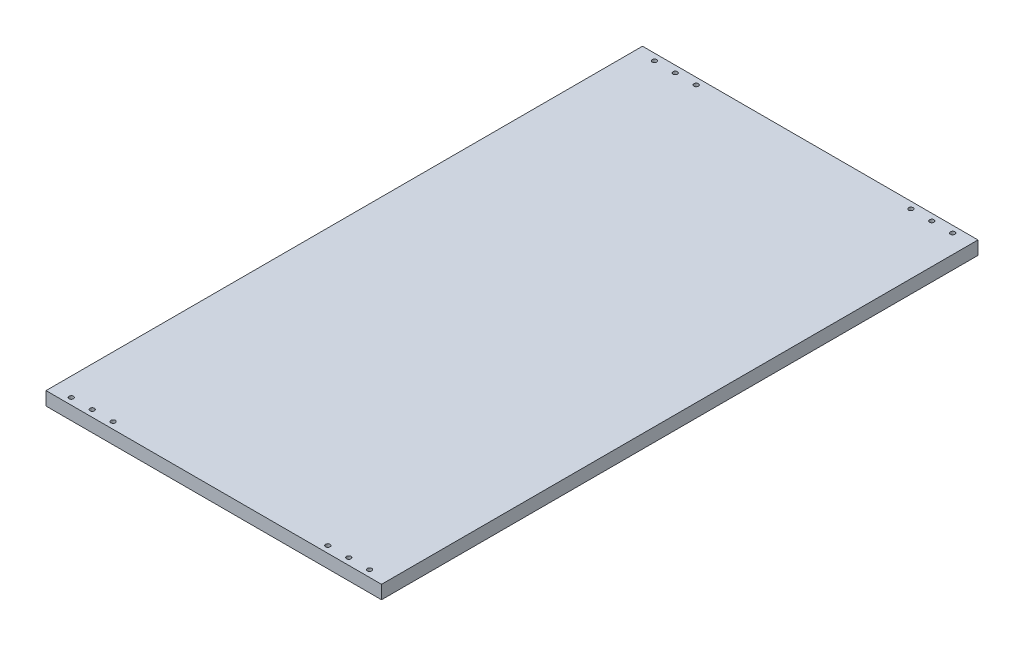
from build123d import *

# Parameters (mm, degrees)
SKETCH_1_W          = 450
SKETCH_1_H          = 800
EXTRUDE_1_DEPTH     = 18
SKETCH_2_R          = 3
CUT_EXTRUDE_1_DEPTH = 9


with BuildPart() as part:
    # Эскиз1 → Бобышка-Вытянуть1 (new body)
    with BuildSketch(Plane(origin=(0, 0, 0), x_dir=(1, 0, 0), z_dir=(0, 1, 0))):
        with Locations((225, 400)):
            Rectangle(SKETCH_1_W, SKETCH_1_H)
    extrude(amount=EXTRUDE_1_DEPTH)

    # Эскиз2 → Вырез-Вытянуть1 (cut)
    with BuildSketch(Plane(origin=(0, 18, 0), x_dir=(1, 0, 0), z_dir=(0, 1, 0))):
        with Locations((25, 9)):
            Circle(SKETCH_2_R)
        with Locations((53, 9)):
            Circle(SKETCH_2_R)
        with Locations((81, 9)):
            Circle(SKETCH_2_R)
        with Locations((369, 9)):
            Circle(SKETCH_2_R)
        with Locations((397, 9)):
            Circle(SKETCH_2_R)
        with Locations((425, 9)):
            Circle(SKETCH_2_R)
        with Locations((425, 791)):
            Circle(SKETCH_2_R)
        with Locations((397, 791)):
            Circle(SKETCH_2_R)
        with Locations((369, 791)):
            Circle(SKETCH_2_R)
        with Locations((81, 791)):
            Circle(SKETCH_2_R)
        with Locations((53, 791)):
            Circle(SKETCH_2_R)
        with Locations((25, 791)):
            Circle(SKETCH_2_R)
    extrude(amount=-CUT_EXTRUDE_1_DEPTH, mode=Mode.SUBTRACT)


solid = part.part
